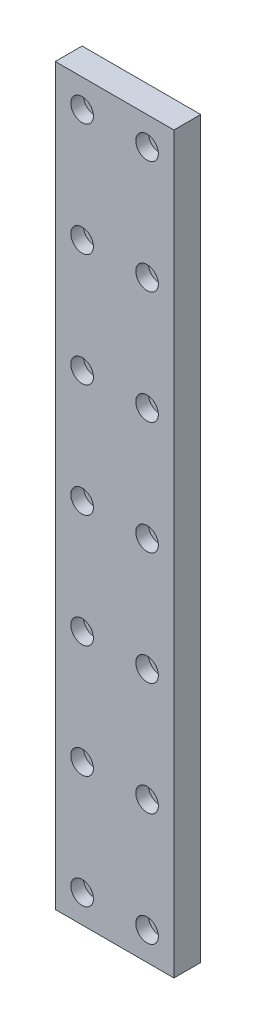
from build123d import *

# Parameters (mm, degrees)
SKETCH_1_W          = 42
SKETCH_1_H          = 260
EXTRUDE_1_DEPTH     = 9.5
SKETCH_2_R          = 2.25
CUT_EXTRUDE_1_DEPTH = 133.027459265
SKETCH_3_R          = 4
CUT_EXTRUDE_2_DEPTH = 4.5


with BuildPart() as part:
    # 草圖1 → 填料-伸長1 (new body)
    with BuildSketch(Plane.XY):
        Rectangle(SKETCH_1_W, SKETCH_1_H)
    extrude(amount=EXTRUDE_1_DEPTH)

    # 草圖2 → 除料-伸長1 (cut, through all)
    with BuildSketch(Plane.XY.offset(9.5)):
        with Locations((-11.5, 120)):
            Circle(SKETCH_2_R)
        with Locations((11.5, 120)):
            Circle(SKETCH_2_R)
        with Locations((-11.5, 80)):
            Circle(SKETCH_2_R)
        with Locations((11.5, 80)):
            Circle(SKETCH_2_R)
        with Locations((-11.5, 40)):
            Circle(SKETCH_2_R)
        with Locations((11.5, 40)):
            Circle(SKETCH_2_R)
        with Locations((-11.5, 0)):
            Circle(SKETCH_2_R)
        with Locations((11.5, 0)):
            Circle(SKETCH_2_R)
        with Locations((-11.5, -40)):
            Circle(SKETCH_2_R)
        with Locations((11.5, -40)):
            Circle(SKETCH_2_R)
        with Locations((-11.5, -80)):
            Circle(SKETCH_2_R)
        with Locations((11.5, -80)):
            Circle(SKETCH_2_R)
        with Locations((-11.5, -120)):
            Circle(SKETCH_2_R)
        with Locations((11.5, -120)):
            Circle(SKETCH_2_R)
    extrude(amount=-CUT_EXTRUDE_1_DEPTH, mode=Mode.SUBTRACT)

    # 草圖3 → 除料-伸長2 (cut)
    with BuildSketch(Plane.XY.offset(9.5)):
        with Locations((-11.5, 120)):
            Circle(SKETCH_3_R)
        with Locations((11.5, 120)):
            Circle(SKETCH_3_R)
        with Locations((-11.5, 80)):
            Circle(SKETCH_3_R)
        with Locations((11.5, 80)):
            Circle(SKETCH_3_R)
        with Locations((-11.5, 40)):
            Circle(SKETCH_3_R)
        with Locations((11.5, 40)):
            Circle(SKETCH_3_R)
        with Locations((-11.5, 0)):
            Circle(SKETCH_3_R)
        with Locations((11.5, 0)):
            Circle(SKETCH_3_R)
        with Locations((-11.5, -40)):
            Circle(SKETCH_3_R)
        with Locations((11.5, -40)):
            Circle(SKETCH_3_R)
        with Locations((-11.5, -80)):
            Circle(SKETCH_3_R)
        with Locations((11.5, -80)):
            Circle(SKETCH_3_R)
        with Locations((-11.5, -120)):
            Circle(SKETCH_3_R)
        with Locations((11.5, -120)):
            Circle(SKETCH_3_R)
    extrude(amount=-CUT_EXTRUDE_2_DEPTH, mode=Mode.SUBTRACT)


solid = part.part
